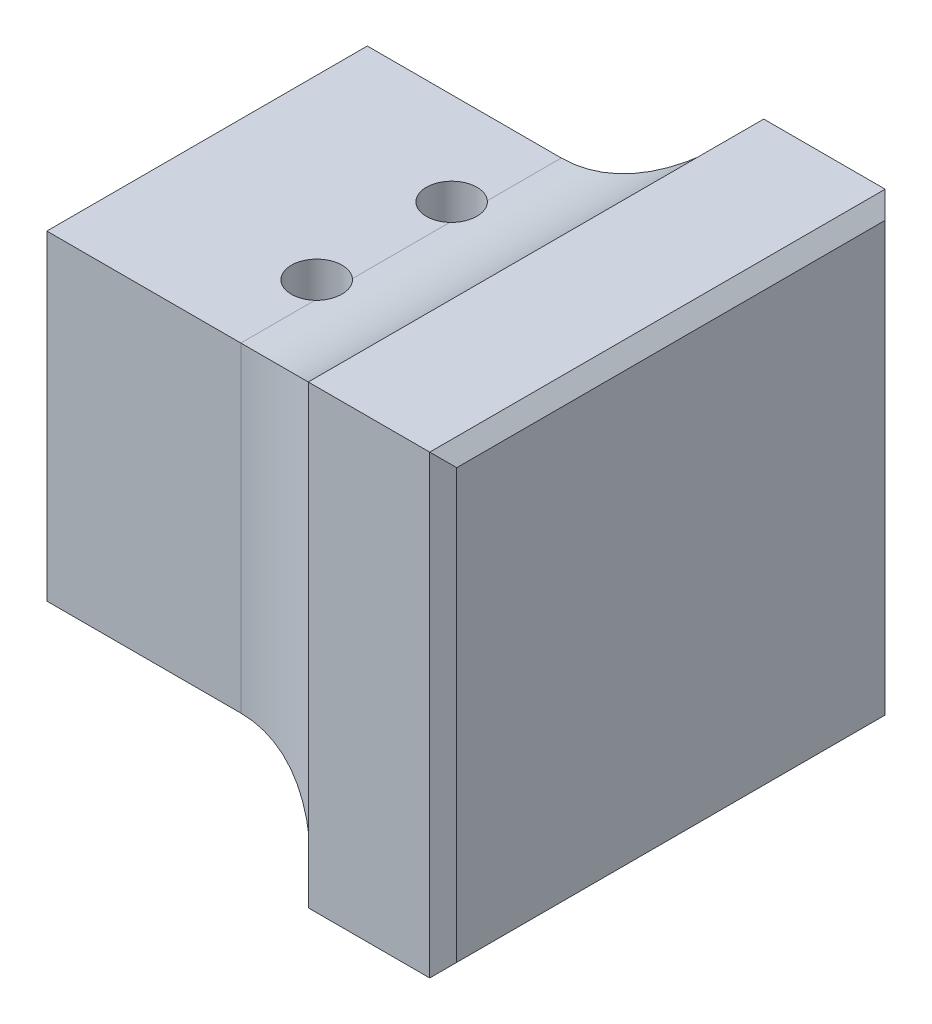
from build123d import *

# Parameters (mm, degrees)
SKETCH1_W           = 21
SKETCH1_H           = 19
SKETCH1_R           = 1.5
BOSS_EXTRUDE1_DEPTH = 19
CHAMFER1_SIZE       = 1.5
SKETCH2_W           = 27
SKETCH2_H           = 27
BOSS_EXTRUDE2_DEPTH = 8
FILLET1_R           = 10
CHAMFER2_SIZE       = 0.8


with BuildPart() as part:
    # Sketch1 → Boss-Extrude1 (new body)
    with BuildSketch(Plane(origin=(0, 0, 0), x_dir=(1, 0, 0), z_dir=(0, 1, 0))):
        with Locations((10.5, 9.5)):
            Rectangle(SKETCH1_W, SKETCH1_H)
        with Locations(Location((12, 13.5, 0), (0, 0, 270))):
            Circle(SKETCH1_R, mode=Mode.SUBTRACT)
        with Locations(Location((12, 5.5, 0), (0, 0, 270))):
            Circle(SKETCH1_R, mode=Mode.SUBTRACT)
    extrude(amount=BOSS_EXTRUDE1_DEPTH)

    # Chamfer1
    chamfer1_edges = [part.edges().sort_by_distance(p)[0] for p in [
        (0, 19, -9.5),
        (0, 0, -9.5),
        (0, 9.5, -19),
        (0, 9.5, 0),
    ]]
    chamfer(chamfer1_edges, length=CHAMFER1_SIZE)

    # Sketch2 → Boss-Extrude2 (add)
    with BuildSketch(Plane(origin=(21, 0, 0), x_dir=(0, 0, -1), z_dir=(1, 0, 0))):
        with Locations((9.5, 9.5)):
            Rectangle(SKETCH2_W, SKETCH2_H)
    extrude(amount=BOSS_EXTRUDE2_DEPTH)

    # Fillet1
    # the kernel refuses this fillet: 10 mm, written as the material it adds along each edge
    with BuildSketch(Plane(origin=(21, 19, 0), x_dir=(0, 1, 0), z_dir=(0, 0, -1))) as fillet1_piece_1_section:
        with BuildLine():
            CenterArc((10, -8), FILLET1_R, 126.869897646, 53.130102354)
            Line((0, -8), (-0.2, -8))
            Line((-0.2, -8), (-0.2, 0))
            Line((-0.2, 0), (0, 0.2))
            ThreePointArc((0, 0.2), (2, 0.2), (3.88, 0.16))
            Line((3.88, 0.16), (4, 0))
        make_face()
    fillet1_piece_1 = extrude(amount=19, mode=Mode.PRIVATE)
    fillet1_piece_1 = fillet1_piece_1 - Plane(origin=(12, 20.025432283, -13.5), x_dir=(0, 0, 1), z_dir=(0, -1, 0)) * Cylinder(1.5, 70, mode=Mode.PRIVATE)
    fillet1_piece_1 = fillet1_piece_1 - Plane(origin=(12, 20.025432283, -5.5), x_dir=(0, 0, 1), z_dir=(0, -1, 0)) * Cylinder(1.5, 70, mode=Mode.PRIVATE)
    add(fillet1_piece_1)
    with BuildSketch(Plane(origin=(21, 0, 0), x_dir=(0, -1, 0), z_dir=(0, 0, -1))) as fillet1_piece_2_section:
        with BuildLine():
            CenterArc((10, 8), FILLET1_R, 180, 53.130102354)
            Line((0, 8), (-0.2, 8))
            Line((-0.2, 8), (-0.2, 0))
            Line((-0.2, 0), (0, -0.2))
            ThreePointArc((0, -0.2), (2, -0.2), (3.88, -0.16))
            Line((3.88, -0.16), (4, 0))
        make_face()
    fillet1_piece_2 = extrude(amount=19, mode=Mode.PRIVATE)
    fillet1_piece_2 = fillet1_piece_2 - Plane(origin=(12, -1.025432283, -13.5), x_dir=(0, 0, 1), z_dir=(0, -1, 0)) * Cylinder(1.5, 70, mode=Mode.PRIVATE)
    fillet1_piece_2 = fillet1_piece_2 - Plane(origin=(12, -1.025432283, -5.5), x_dir=(0, 0, 1), z_dir=(0, -1, 0)) * Cylinder(1.5, 70, mode=Mode.PRIVATE)
    add(fillet1_piece_2)
    with BuildSketch(Plane(origin=(21, 0, -19), x_dir=(0, 0, -1), z_dir=(0, 1, 0))) as fillet1_piece_3:
        with BuildLine():
            CenterArc((10, 8), FILLET1_R, 180, 53.130102354)
            Line((0, 8), (-0.2, 8))
            Line((-0.2, 8), (-0.2, 0))
            Line((-0.2, 0), (0, -0.2))
            ThreePointArc((0, -0.2), (2, -0.2), (3.88, -0.16))
            Line((3.88, -0.16), (4, 0))
        make_face()
    extrude(amount=19)
    with BuildSketch(Plane(origin=(21, 0, 0), x_dir=(0, 0, 1), z_dir=(0, 1, 0))) as fillet1_piece_4:
        with BuildLine():
            CenterArc((10, -8), FILLET1_R, 126.869897646, 53.130102354)
            Line((0, -8), (-0.2, -8))
            Line((-0.2, -8), (-0.2, 0))
            Line((-0.2, 0), (0, 0.2))
            ThreePointArc((0, 0.2), (2, 0.2), (3.88, 0.16))
            Line((3.88, 0.16), (4, 0))
        make_face()
    extrude(amount=19)
    with BuildSketch(Plane(origin=(21, 19, 20), x_dir=(0, 1, 0), z_dir=(0, 0, -1))) as fillet1_piece_5a_section:
        with BuildLine():
            CenterArc((10, -8), FILLET1_R, 126.869897646, 53.130102354)
            Line((0, -8), (-0.2, -8))
            Line((-0.2, -8), (-0.2, 0))
            Line((-0.2, 0), (0, 0.2))
            ThreePointArc((0, 0.2), (2, 0.2), (3.88, 0.16))
            Line((3.88, 0.16), (4, 0))
        make_face()
    fillet1_piece_5a = extrude(amount=39, mode=Mode.PRIVATE)
    fillet1_piece_5a = split(fillet1_piece_5a, bisect_by=Plane(origin=(18.941165886, 20.023885124, 4), z_dir=(0, 0, -1)), keep=Keep.TOP, mode=Mode.PRIVATE)
    fillet1_piece_5a = split(fillet1_piece_5a, bisect_by=Plane(origin=(18.941165886, 20.023885124, 0), z_dir=(0, 0, 1)), keep=Keep.TOP, mode=Mode.PRIVATE)
    with BuildSketch(Plane(origin=(21, 0, 0), x_dir=(0, 0, 1), z_dir=(0, 1, 0))) as fillet1_piece_5b_section:
        with BuildLine():
            CenterArc((10, -8), FILLET1_R, 126.869897646, 53.130102354)
            Line((0, -8), (-0.2, -8))
            Line((-0.2, -8), (-0.2, 0))
            Line((-0.2, 0), (0, 0.2))
            ThreePointArc((0, 0.2), (2, 0.2), (3.88, 0.16))
            Line((3.88, 0.16), (4, 0))
        make_face()
    fillet1_piece_5b = extrude(amount=39, mode=Mode.PRIVATE)
    fillet1_piece_5b = split(fillet1_piece_5b, bisect_by=Plane(origin=(18.941165886, 23, 1.023885124), z_dir=(0, -1, 0)), keep=Keep.TOP, mode=Mode.PRIVATE)
    fillet1_piece_5b = split(fillet1_piece_5b, bisect_by=Plane(origin=(18.941165886, 19, 1.023885124), z_dir=(0, 1, 0)), keep=Keep.TOP, mode=Mode.PRIVATE)
    fillet1_piece_5 = fillet1_piece_5a & fillet1_piece_5b
    add(fillet1_piece_5)
    with BuildSketch(Plane(origin=(21, 0, -19), x_dir=(0, 0, -1), z_dir=(0, 1, 0))) as fillet1_piece_6a_section:
        with BuildLine():
            CenterArc((10, 8), FILLET1_R, 180, 53.130102354)
            Line((0, 8), (-0.2, 8))
            Line((-0.2, 8), (-0.2, 0))
            Line((-0.2, 0), (0, -0.2))
            ThreePointArc((0, -0.2), (2, -0.2), (3.88, -0.16))
            Line((3.88, -0.16), (4, 0))
        make_face()
    fillet1_piece_6a = extrude(amount=39, mode=Mode.PRIVATE)
    fillet1_piece_6a = split(fillet1_piece_6a, bisect_by=Plane(origin=(18.941165886, 23, -20.023885124), z_dir=(0, -1, 0)), keep=Keep.TOP, mode=Mode.PRIVATE)
    fillet1_piece_6a = split(fillet1_piece_6a, bisect_by=Plane(origin=(18.941165886, 19, -20.023885124), z_dir=(0, 1, 0)), keep=Keep.TOP, mode=Mode.PRIVATE)
    with BuildSketch(Plane(origin=(21, 19, 0), x_dir=(0, 1, 0), z_dir=(0, 0, -1))) as fillet1_piece_6b_section:
        with BuildLine():
            CenterArc((10, -8), FILLET1_R, 126.869897646, 53.130102354)
            Line((0, -8), (-0.2, -8))
            Line((-0.2, -8), (-0.2, 0))
            Line((-0.2, 0), (0, 0.2))
            ThreePointArc((0, 0.2), (2, 0.2), (3.88, 0.16))
            Line((3.88, 0.16), (4, 0))
        make_face()
    fillet1_piece_6b = extrude(amount=39, mode=Mode.PRIVATE)
    fillet1_piece_6b = split(fillet1_piece_6b, bisect_by=Plane(origin=(18.941165886, 20.023885124, -23), z_dir=(0, 0, 1)), keep=Keep.TOP, mode=Mode.PRIVATE)
    fillet1_piece_6b = split(fillet1_piece_6b, bisect_by=Plane(origin=(18.941165886, 20.023885124, -19), z_dir=(0, 0, -1)), keep=Keep.TOP, mode=Mode.PRIVATE)
    fillet1_piece_6 = fillet1_piece_6a & fillet1_piece_6b
    add(fillet1_piece_6)
    with BuildSketch(Plane(origin=(21, 0, 20), x_dir=(0, -1, 0), z_dir=(0, 0, -1))) as fillet1_piece_7a_section:
        with BuildLine():
            CenterArc((10, 8), FILLET1_R, 180, 53.130102354)
            Line((0, 8), (-0.2, 8))
            Line((-0.2, 8), (-0.2, 0))
            Line((-0.2, 0), (0, -0.2))
            ThreePointArc((0, -0.2), (2, -0.2), (3.88, -0.16))
            Line((3.88, -0.16), (4, 0))
        make_face()
    fillet1_piece_7a = extrude(amount=39, mode=Mode.PRIVATE)
    fillet1_piece_7a = split(fillet1_piece_7a, bisect_by=Plane(origin=(18.941165886, -1.023885124, 4), z_dir=(0, 0, -1)), keep=Keep.TOP, mode=Mode.PRIVATE)
    fillet1_piece_7a = split(fillet1_piece_7a, bisect_by=Plane(origin=(18.941165886, -1.023885124, 0), z_dir=(0, 0, 1)), keep=Keep.TOP, mode=Mode.PRIVATE)
    with BuildSketch(Plane(origin=(21, -20, 0), x_dir=(0, 0, 1), z_dir=(0, 1, 0))) as fillet1_piece_7b_section:
        with BuildLine():
            CenterArc((10, -8), FILLET1_R, 126.869897646, 53.130102354)
            Line((0, -8), (-0.2, -8))
            Line((-0.2, -8), (-0.2, 0))
            Line((-0.2, 0), (0, 0.2))
            ThreePointArc((0, 0.2), (2, 0.2), (3.88, 0.16))
            Line((3.88, 0.16), (4, 0))
        make_face()
    fillet1_piece_7b = extrude(amount=39, mode=Mode.PRIVATE)
    fillet1_piece_7b = split(fillet1_piece_7b, bisect_by=Plane(origin=(18.941165886, -4, 1.023885124), z_dir=(0, 1, 0)), keep=Keep.TOP, mode=Mode.PRIVATE)
    fillet1_piece_7b = split(fillet1_piece_7b, bisect_by=Plane(origin=(18.941165886, 0, 1.023885124), z_dir=(0, -1, 0)), keep=Keep.TOP, mode=Mode.PRIVATE)
    fillet1_piece_7 = fillet1_piece_7a & fillet1_piece_7b
    add(fillet1_piece_7)
    with BuildSketch(Plane(origin=(21, 0, 0), x_dir=(0, -1, 0), z_dir=(0, 0, -1))) as fillet1_piece_8a_section:
        with BuildLine():
            CenterArc((10, 8), FILLET1_R, 180, 53.130102354)
            Line((0, 8), (-0.2, 8))
            Line((-0.2, 8), (-0.2, 0))
            Line((-0.2, 0), (0, -0.2))
            ThreePointArc((0, -0.2), (2, -0.2), (3.88, -0.16))
            Line((3.88, -0.16), (4, 0))
        make_face()
    fillet1_piece_8a = extrude(amount=39, mode=Mode.PRIVATE)
    fillet1_piece_8a = split(fillet1_piece_8a, bisect_by=Plane(origin=(18.941165886, -1.023885124, -23), z_dir=(0, 0, 1)), keep=Keep.TOP, mode=Mode.PRIVATE)
    fillet1_piece_8a = split(fillet1_piece_8a, bisect_by=Plane(origin=(18.941165886, -1.023885124, -19), z_dir=(0, 0, -1)), keep=Keep.TOP, mode=Mode.PRIVATE)
    with BuildSketch(Plane(origin=(21, -20, -19), x_dir=(0, 0, -1), z_dir=(0, 1, 0))) as fillet1_piece_8b_section:
        with BuildLine():
            CenterArc((10, 8), FILLET1_R, 180, 53.130102354)
            Line((0, 8), (-0.2, 8))
            Line((-0.2, 8), (-0.2, 0))
            Line((-0.2, 0), (0, -0.2))
            ThreePointArc((0, -0.2), (2, -0.2), (3.88, -0.16))
            Line((3.88, -0.16), (4, 0))
        make_face()
    fillet1_piece_8b = extrude(amount=39, mode=Mode.PRIVATE)
    fillet1_piece_8b = split(fillet1_piece_8b, bisect_by=Plane(origin=(18.941165886, -4, -20.023885124), z_dir=(0, 1, 0)), keep=Keep.TOP, mode=Mode.PRIVATE)
    fillet1_piece_8b = split(fillet1_piece_8b, bisect_by=Plane(origin=(18.941165886, 0, -20.023885124), z_dir=(0, -1, 0)), keep=Keep.TOP, mode=Mode.PRIVATE)
    fillet1_piece_8 = fillet1_piece_8a & fillet1_piece_8b
    add(fillet1_piece_8)

    # Chamfer2
    chamfer2_edges = [part.edges().sort_by_distance(p)[0] for p in [
        (29, 9.5, 4),
        (29, -4, -9.5),
        (29, 9.5, -23),
        (29, 23, -9.5),
    ]]
    chamfer(chamfer2_edges, length=CHAMFER2_SIZE)


solid = part.part
